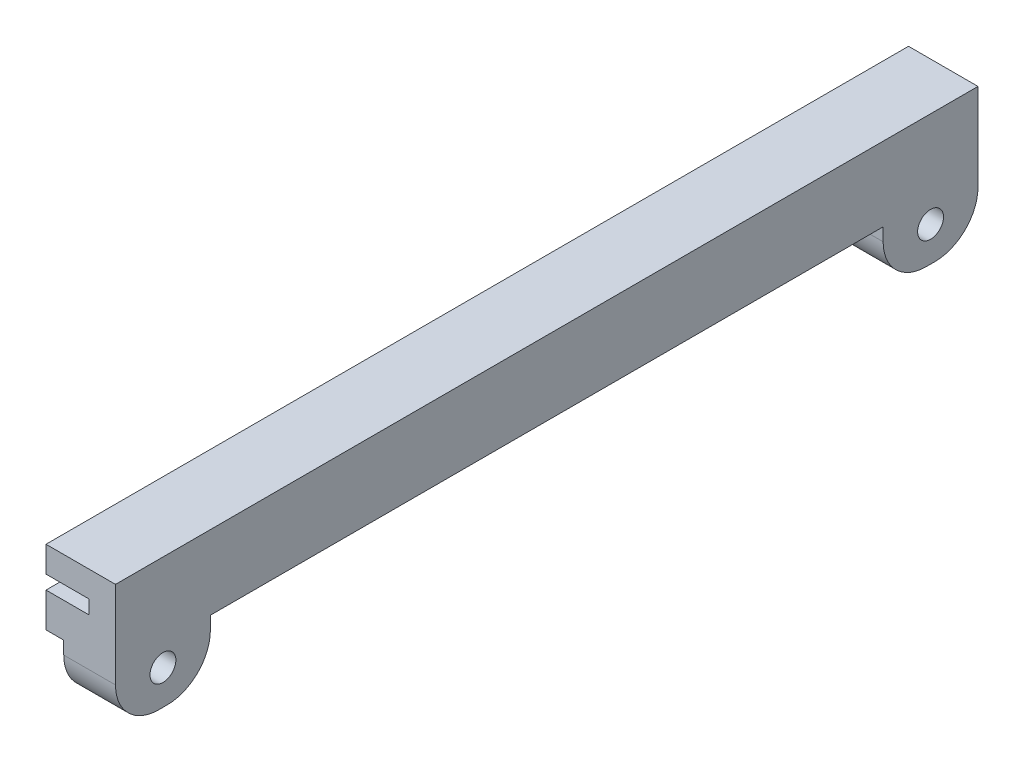
from build123d import *
from build123d.topology import SkipClean

# Parameters (mm, degrees)
SKETCH1_W           = 7.0575
SKETCH1_H           = 100
BOSS_EXTRUDE2_DEPTH = 7.6
SKETCH4_W           = 5
SKETCH4_H           = 93.218
CUT_EXTRUDE1_DEPTH  = 4.6
SKETCH6_W           = 5
SKETCH6_H           = 93.218
BOSS_EXTRUDE3_DEPTH = 3
SKETCH8_W           = 7.0575
SKETCH8_H           = 100
BOSS_EXTRUDE4_DEPTH = 1
SKETCH9_W           = 5
SKETCH9_H           = 11
BOSS_EXTRUDE5_DEPTH = 6.5
CUT_EXTRUDE2_DEPTH  = 2.4
SKETCH11_R          = 1.5
CUT_EXTRUDE3_DEPTH  = 51.77035854
FILLET2_R           = 5
SKETCH13_R          = 1.5
BOSS_EXTRUDE6_DEPTH = 1


with BuildPart() as part:
    # Sketch1 → Boss-Extrude2 (new body)
    with BuildSketch(Plane(origin=(0, 0, 0), x_dir=(1, 0, 0), z_dir=(0, 1, 0))):
        Rectangle(SKETCH1_W, SKETCH1_H)
    extrude(amount=BOSS_EXTRUDE2_DEPTH)

    # Sketch4 → Cut-Extrude1 (cut)
    with BuildSketch(Plane(origin=(0, 7.6, 0), x_dir=(1, 0, 0), z_dir=(0, 1, 0))):
        with Locations((1.02875, -3.391)):
            Rectangle(SKETCH4_W, SKETCH4_H)
    extrude(amount=-CUT_EXTRUDE1_DEPTH, mode=Mode.SUBTRACT)

    # Sketch6 → Boss-Extrude3 (add)
    with BuildSketch(Plane(origin=(0, 7.6, 0), x_dir=(1, 0, 0), z_dir=(0, 1, 0))):
        with Locations((1.02875, -3.391)):
            Rectangle(SKETCH6_W, SKETCH6_H)
    extrude(amount=-BOSS_EXTRUDE3_DEPTH)

    # Sketch8 → Boss-Extrude4 (add)
    with BuildSketch(Plane.XZ):
        Rectangle(SKETCH8_W, SKETCH8_H)
    extrude(amount=BOSS_EXTRUDE4_DEPTH)

    # Sketch9 → Boss-Extrude5 (add)
    with BuildSketch(Plane.XZ.offset(1)):
        with Locations((-1.02875, 44.5)):
            Rectangle(SKETCH9_W, SKETCH9_H)
        with Locations((-1.02875, -44.5)):
            Rectangle(SKETCH9_W, SKETCH9_H)
    extrude(amount=BOSS_EXTRUDE5_DEPTH)

    # Sketch10 → Cut-Extrude2 (cut)
    with BuildSketch(Plane(origin=(1.47125, 0, 0), x_dir=(0, 0, -1), z_dir=(1, 0, 0))):
        Polygon((-46.08771324, -0.75), (-47.675426481, -3.5), (-46.08771324, -6.25), (-42.91228676, -6.25), (-41.324573519, -3.5), (-42.91228676, -0.75), align=None)
        Polygon((47.675426481, -3.5), (46.08771324, -0.75), (42.91228676, -0.75), (41.324573519, -3.5), (42.91228676, -6.25), (46.08771324, -6.25), align=None)
    extrude(amount=-CUT_EXTRUDE2_DEPTH, mode=Mode.SUBTRACT)

    # Sketch11 → Cut-Extrude3 (cut, through all)
    with BuildSketch(Plane(origin=(-0.92875, 0, 0), x_dir=(0, 0, -1), z_dir=(1, 0, 0))):
        with Locations((-44.5, -3.5)):
            Circle(SKETCH11_R)
        with Locations((44.5, -3.5)):
            Circle(SKETCH11_R)
    extrude(amount=-CUT_EXTRUDE3_DEPTH, mode=Mode.SUBTRACT)

    # Fillet2
    fillet2_edges = [part.edges().sort_by_distance(p)[0] for p in [
        (-1.02875, -7.5, -50),
        (-1.02875, -7.5, -39),
        (-1.02875, -7.5, 39),
        (-1.02875, -7.5, 50),
    ]]
    fillet(fillet2_edges, radius=FILLET2_R)

    # Sketch13 → Boss-Extrude6 (add)
    with SkipClean():  # the faces are left unmerged after this step: merging them gives an invalid solid
        with BuildSketch(Plane.ZY.offset(3.52875)):
            with BuildLine():
                Line((-45, -7.5), (-44, -7.5))
                ThreePointArc((-44, -7.5), (-40.464466094, -6.035533906), (-39, -2.5))
                Line((-39, -2.5), (-39, -1))
                Line((-39, -1), (39, -1))
                Line((39, -1), (39, -2.5))
                ThreePointArc((39, -2.5), (40.464466094, -6.035533906), (44, -7.5))
                Line((44, -7.5), (45, -7.5))
                ThreePointArc((45, -7.5), (48.535533906, -6.035533906), (50, -2.5))
                Line((50, -2.5), (50, 7.6))
                Line((50, 7.6), (-50, 7.6))
                Line((-50, 7.6), (-50, -2.5))
                ThreePointArc((-50, -2.5), (-48.535533906, -6.035533906), (-45, -7.5))
            make_face()
            with Locations((-44.5, -3.5)):
                Circle(SKETCH13_R, mode=Mode.SUBTRACT)
            with Locations((44.5, -3.5)):
                Circle(SKETCH13_R, mode=Mode.SUBTRACT)
        extrude(amount=BOSS_EXTRUDE6_DEPTH)


with BuildPart() as body_2:
    # Mirror2: mirrored copy
    add(part.part.mirror(Plane(origin=(3.52875, 7.6, 50), x_dir=(0, 0, 1), z_dir=(-1, 0, 0))))


solid = body_2.part
